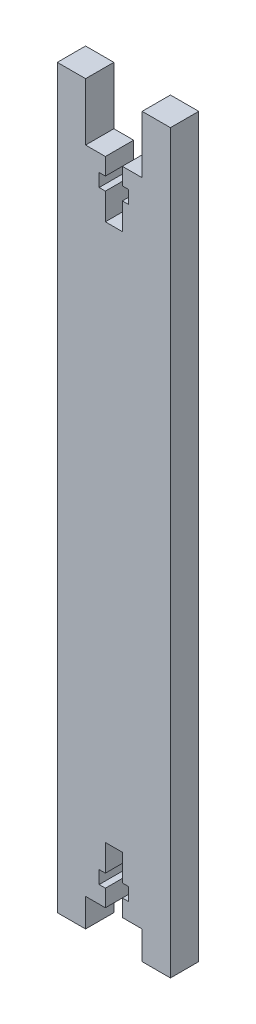
from build123d import *

# Parameters (mm, degrees)
BOSS_EXTRUDE1_DEPTH = 5


with BuildPart() as part:
    # Sketch1 → Boss-Extrude1 (new body)
    with BuildSketch(Plane.XY):
        Polygon((-1.5, 0), (-5, 0), (-5, -5), (-10, -5), (-10, 0), (-10, 115), (-10, 120), (-10, 125.163019323), (-5, 125.163019323), (-5, 120), (-5, 115), (-1.5, 115), (-1.5, 112), (-2.6, 112), (-2.6, 109.7), (-1.5, 109.7), (-1.5, 105), (1.5, 105), (1.5, 109.7), (2.6, 109.7), (2.6, 112), (1.5, 112), (1.5, 115), (5, 115), (5, 120), (5, 125.163019323), (10, 125.163019323), (10, 120), (10, 115), (10, 0), (10, -5), (5, -5), (5, 0), (1.5, 0), (1.5, 3), (2.6, 3), (2.6, 5.3), (1.5, 5.3), (1.5, 10), (-1.5, 10), (-1.5, 5.3), (-2.6, 5.3), (-2.6, 3), (-1.5, 3), align=None)
    extrude(amount=BOSS_EXTRUDE1_DEPTH)


solid = part.part
